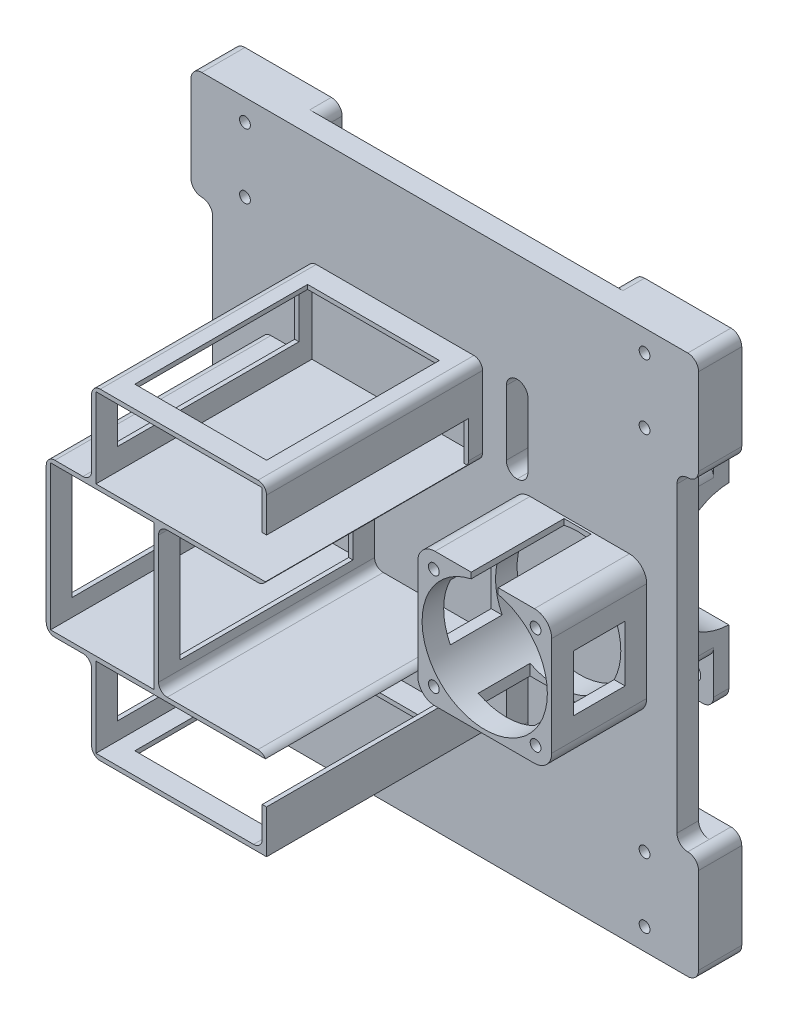
from build123d import *

# Parameters (mm, degrees)
ESQUISSE1_R              = 0.005
ESQUISSE1_W              = 10
ESQUISSE1_H              = 40
BOSS_EXTRU_2_DEPTH       = 10
ESQUISSE4_W              = 50
ESQUISSE4_H              = 50
BOSS_EXTRU_3_DEPTH       = 10
ESQUISSE6_W              = 20
ESQUISSE6_H              = 78
BOSS_EXTRU_5_DEPTH       = 45
CONG_1_R                 = 5
ESQUISSE8_R              = 28.5
ENL_V_MAT_EXTRU_2_DEPTH  = 100
ESQUISSE12_W             = 20
ESQUISSE12_H             = 8
BOSS_EXTRU_6_DEPTH       = 20
ESQUISSE13_W             = 20
ESQUISSE13_H             = 8
BOSS_EXTRU_7_DEPTH       = 20
CONG_55_R                = 5
ESQUISSE14_R             = 4
ENL_V_MAT_EXTRU_4_DEPTH  = 10
ESQUISSE15_W             = 20
ESQUISSE15_H             = 1
ENL_V_MAT_EXTRU_5_DEPTH  = 120
ESQUISSE19_W             = 62
ESQUISSE19_H             = 62
ESQUISSE19_W_2           = 40
ESQUISSE19_H_2           = 40
BOSS_EXTRU_8_DEPTH       = 44
ESQUISSE20_R             = 29
ESQUISSE20_R_2           = 15
ENL_V_MAT_EXTRU_7_DEPTH  = 44
CONG_57_R                = 8
ESQUISSE21_W             = 12.5
ESQUISSE21_H             = 6
ENL_V_MAT_EXTRU_8_DEPTH  = 43
ENL_V_MAT_EXTRU_9_DEPTH  = 10
ESQUISSE23_R             = 2.5
ENL_V_MAT_EXTRU_10_DEPTH = 10
ESQUISSE24_W             = 24
ESQUISSE24_H             = 26
ENL_V_MAT_EXTRU_11_DEPTH = 66
ESQUISSE25_W             = 26
ESQUISSE25_H             = 24
ENL_V_MAT_EXTRU_12_DEPTH = 42
BOSS_EXTRU_9_DEPTH       = 100
ESQUISSE31_W             = 77
ESQUISSE31_H             = 37
ESQUISSE31_W_2           = 48
ESQUISSE31_H_2           = 67
ENL_V_MAT_EXTRU_17_DEPTH = 100
ESQUISSE35_W             = 61
ESQUISSE35_H             = 80
ENL_V_MAT_EXTRU_20_DEPTH = 2
ESQUISSE36_W             = 84
ESQUISSE36_H             = 19
ENL_V_MAT_EXTRU_26_DEPTH = 2
ESQUISSE37_W             = 80
ESQUISSE37_H             = 51
ENL_V_MAT_EXTRU_22_DEPTH = 52
CONG_58_R                = 4
ESQUISSE38_W             = 61
ESQUISSE38_H             = 80
ENL_V_MAT_EXTRU_23_DEPTH = 2
ESQUISSE39_W             = 93.5
ESQUISSE39_H             = 19
ESQUISSE39_W_2           = 80
ENL_V_MAT_EXTRU_24_DEPTH = 2
ESQUISSE42_R             = 2.5
ENL_V_MAT_EXTRU_29_DEPTH = 10
ESQUISSE43_R             = 2.6
ENL_V_MAT_EXTRU_30_DEPTH = 20


with BuildPart() as part:
    # Esquisse1 → Boss.-Extru.2 (new body)
    with BuildSketch(Plane.XY):
        Polygon((235, 50), (235, 0), (0, 0), (0, 50), (10, 50), (10, 200), (0, 200), (0, 250), (235, 250), (235, 200), (225, 200), (225, 50), align=None)
        with Locations((117.5, 125)):
            Circle(ESQUISSE1_R, mode=Mode.SUBTRACT)
        with Locations((151, 70)):
            Rectangle(ESQUISSE1_W, ESQUISSE1_H, mode=Mode.SUBTRACT)
        with Locations((151, 180)):
            Rectangle(ESQUISSE1_W, ESQUISSE1_H, mode=Mode.SUBTRACT)
    extrude(amount=BOSS_EXTRU_2_DEPTH)

    # Esquisse4 → Boss.-Extru.3 (add)
    with BuildSketch(Plane(origin=(0, 0, 0), x_dir=(-1, 0, 0), z_dir=(0, 0, -1))):
        with Locations((-25, 225)):
            Rectangle(ESQUISSE4_W, ESQUISSE4_H)
        with Locations((-210, 225)):
            Rectangle(ESQUISSE4_W, ESQUISSE4_H)
        with Locations((-210, 25)):
            Rectangle(ESQUISSE4_W, ESQUISSE4_H)
        with Locations((-25, 25)):
            Rectangle(ESQUISSE4_W, ESQUISSE4_H)
    extrude(amount=BOSS_EXTRU_3_DEPTH)

    # Esquisse6 → Boss.-Extru.5 (add)
    with BuildSketch(Plane(origin=(0, 0, 0), x_dir=(-1, 0, 0), z_dir=(0, 0, -1))):
        with Locations((-116, 125)):
            Rectangle(ESQUISSE6_W, ESQUISSE6_H)
        with Locations((-185, 125)):
            Rectangle(ESQUISSE6_W, ESQUISSE6_H)
    extrude(amount=BOSS_EXTRU_5_DEPTH)

    # Congé1
    cong_1_edges = [part.edges().sort_by_distance(p)[0] for p in [
        (50, 250, -5),
        (50, 200, -5),
        (185, 250, -5),
        (185, 200, -5),
        (235, 50, 0),
        (235, 200, 0),
        (0, 50, 0),
        (0, 200, 0),
        (225, 50, 5),
        (225, 200, 5),
        (10, 50, 5),
        (10, 200, 5),
        (235, 250, 0),
        (0, 250, 0),
        (0, 0, 0),
        (235, 0, 0),
        (50, 50, -5),
        (185, 50, -5),
        (185, 0, -5),
        (50, 0, -5),
        (146, 50, 5),
        (156, 50, 5),
        (156, 90, 5),
        (146, 90, 5),
        (156, 160, 5),
        (146, 160, 5),
        (156, 200, 5),
        (146, 200, 5),
    ]]
    fillet(cong_1_edges, radius=CONG_1_R - 0.0001)  # a hair under: the kernel refuses the full size

    # Esquisse8 → Enlèv. mat.-Extru.2 (cut)
    with BuildSketch(Plane(origin=(195, 0, 0), x_dir=(0, 0, -1), z_dir=(1, 0, 0))):
        with Locations((45, 125)):
            Circle(ESQUISSE8_R)
    extrude(amount=-ENL_V_MAT_EXTRU_2_DEPTH, mode=Mode.SUBTRACT)

    # Esquisse12 → Boss.-Extru.6 (add)
    with BuildSketch(Plane(origin=(0, 164, 0), x_dir=(1, 0, 0), z_dir=(0, 1, 0))):
        with Locations((116, 41)):
            Rectangle(ESQUISSE12_W, ESQUISSE12_H)
        with Locations((185, 41)):
            Rectangle(ESQUISSE12_W, ESQUISSE12_H)
    extrude(amount=BOSS_EXTRU_6_DEPTH)

    # Esquisse13 → Boss.-Extru.7 (add)
    with BuildSketch(Plane.XZ.offset(-86)):
        with Locations((116, -41)):
            Rectangle(ESQUISSE13_W, ESQUISSE13_H)
        with Locations((185, -41)):
            Rectangle(ESQUISSE13_W, ESQUISSE13_H)
    extrude(amount=BOSS_EXTRU_7_DEPTH)

    # Congé55
    cong_55_edges = [part.edges().sort_by_distance(p)[0] for p in [
        (126, 164, -18.5),
        (106, 164, -18.5),
        (106, 184, -41),
        (126, 184, -41),
        (195, 164, -18.5),
        (175, 164, -18.5),
        (175, 184, -41),
        (195, 184, -41),
        (106, 86, -18.5),
        (126, 86, -18.5),
        (106, 66, -41),
        (126, 66, -41),
        (175, 86, -18.5),
        (195, 86, -18.5),
        (175, 66, -41),
        (195, 66, -41),
    ]]
    fillet(cong_55_edges, radius=CONG_55_R)

    # Esquisse14 → Enlèv. mat.-Extru.4 (cut)
    with BuildSketch(Plane(origin=(0, 0, -45), x_dir=(-1, 0, 0), z_dir=(0, 0, -1))):
        with Locations((-185, 173.5)):
            Circle(ESQUISSE14_R)
        with Locations((-116, 173.5)):
            Circle(ESQUISSE14_R)
        with Locations((-116, 76.5)):
            Circle(ESQUISSE14_R)
        with Locations((-185, 76.5)):
            Circle(ESQUISSE14_R)
    extrude(amount=-ENL_V_MAT_EXTRU_4_DEPTH, mode=Mode.SUBTRACT)

    # Esquisse15 → Enlèv. mat.-Extru.5 (cut)
    with BuildSketch(Plane.XZ.offset(-66)):
        with Locations((185, -44.5)):
            Rectangle(ESQUISSE15_W, ESQUISSE15_H)
    extrude(amount=-ENL_V_MAT_EXTRU_5_DEPTH, mode=Mode.SUBTRACT)

    # Esquisse19 → Boss.-Extru.8 (add)
    with BuildSketch(Plane.XY.offset(10)):
        with Locations((180, 125)):
            Rectangle(ESQUISSE19_W, ESQUISSE19_H)
        with Locations((180, 125)):
            Rectangle(ESQUISSE19_W_2, ESQUISSE19_H_2, mode=Mode.SUBTRACT)
    extrude(amount=BOSS_EXTRU_8_DEPTH)

    # Esquisse20 → Enlèv. mat.-Extru.7 (cut)
    with BuildSketch(Plane.XY.offset(54)):
        with Locations((180, 125)):
            Circle(ESQUISSE20_R)
        with Locations((180, 125)):
            Circle(ESQUISSE20_R_2, mode=Mode.SUBTRACT)
    extrude(amount=-ENL_V_MAT_EXTRU_7_DEPTH, mode=Mode.SUBTRACT)

    # Congé57
    cong_57_edges = [part.edges().sort_by_distance(p)[0] for p in [
        (211, 94, 32),
        (211, 156, 32),
        (149, 156, 32),
        (149, 94, 32),
    ]]
    fillet(cong_57_edges, radius=CONG_57_R)

    # Esquisse21 → Enlèv. mat.-Extru.8 (cut)
    with BuildSketch(Plane.XY.offset(54)):
        with Locations((180, 155)):
            Rectangle(ESQUISSE21_W, ESQUISSE21_H)
    extrude(amount=-ENL_V_MAT_EXTRU_8_DEPTH, mode=Mode.SUBTRACT)

    # Esquisse22 → Enlèv. mat.-Extru.9 (cut)
    with BuildSketch(Plane.XY):
        with BuildLine():
            Line((12.5, 245), (37.5, 245))
            ThreePointArc((37.5, 245), (42.5, 240), (37.5, 235))
            Line((37.5, 235), (12.5, 235))
            ThreePointArc((12.5, 235), (7.5, 240), (12.5, 245))
        make_face()
        with BuildLine():
            Line((12.5, 215), (37.5, 215))
            ThreePointArc((37.5, 215), (42.5, 210), (37.5, 205))
            Line((37.5, 205), (12.5, 205))
            ThreePointArc((12.5, 205), (7.5, 210), (12.5, 215))
        make_face()
        with BuildLine():
            Line((12.5, 35), (37.5, 35))
            ThreePointArc((37.5, 35), (42.5, 40), (37.5, 45))
            Line((37.5, 45), (12.5, 45))
            ThreePointArc((12.5, 45), (7.5, 40), (12.5, 35))
        make_face()
        with BuildLine():
            Line((12.5, 5), (37.5, 5))
            ThreePointArc((37.5, 5), (42.5, 10), (37.5, 15))
            Line((37.5, 15), (12.5, 15))
            ThreePointArc((12.5, 15), (7.5, 10), (12.5, 5))
        make_face()
        with BuildLine():
            Line((222.5, 5), (197.5, 5))
            ThreePointArc((197.5, 5), (192.5, 10), (197.5, 15))
            Line((197.5, 15), (222.5, 15))
            ThreePointArc((222.5, 15), (227.5, 10), (222.5, 5))
        make_face()
        with BuildLine():
            Line((222.5, 35), (197.5, 35))
            ThreePointArc((197.5, 35), (192.5, 40), (197.5, 45))
            Line((197.5, 45), (222.5, 45))
            ThreePointArc((222.5, 45), (227.5, 40), (222.5, 35))
        make_face()
        with BuildLine():
            Line((222.5, 245), (197.5, 245))
            ThreePointArc((197.5, 245), (192.5, 240), (197.5, 235))
            Line((197.5, 235), (222.5, 235))
            ThreePointArc((222.5, 235), (227.5, 240), (222.5, 245))
        make_face()
        with BuildLine():
            Line((222.5, 215), (197.5, 215))
            ThreePointArc((197.5, 215), (192.5, 210), (197.5, 205))
            Line((197.5, 205), (222.5, 205))
            ThreePointArc((222.5, 205), (227.5, 210), (222.5, 215))
        make_face()
    extrude(amount=-ENL_V_MAT_EXTRU_9_DEPTH, mode=Mode.SUBTRACT)

    # Esquisse23 → Enlèv. mat.-Extru.10 (cut)
    with BuildSketch(Plane.XY):
        with Locations((25, 240)):
            Circle(ESQUISSE23_R)
        with Locations((25, 210)):
            Circle(ESQUISSE23_R)
        with Locations(Location((25, 40, 0), (0, 0, 180))):
            Circle(ESQUISSE23_R)
        with Locations(Location((25, 10, 0), (0, 0, 180))):
            Circle(ESQUISSE23_R)
        with Locations((210, 10)):
            Circle(ESQUISSE23_R)
        with Locations((210, 40)):
            Circle(ESQUISSE23_R)
        with Locations(Location((210, 210, 0), (0, 0, 180))):
            Circle(ESQUISSE23_R)
        with Locations(Location((210, 240, 0), (0, 0, 180))):
            Circle(ESQUISSE23_R)
    extrude(amount=ENL_V_MAT_EXTRU_10_DEPTH, mode=Mode.SUBTRACT)

    # Esquisse24 → Enlèv. mat.-Extru.11 (cut, symmetric)
    with BuildSketch(Plane.ZY.offset(-149)):
        with Locations((32, 125)):
            Rectangle(ESQUISSE24_W, ESQUISSE24_H)
    extrude(amount=ENL_V_MAT_EXTRU_11_DEPTH, both=True, mode=Mode.SUBTRACT)

    # Esquisse25 → Enlèv. mat.-Extru.12 (cut)
    with BuildSketch(Plane.XZ.offset(-94)):
        with Locations((180, 32)):
            Rectangle(ESQUISSE25_W, ESQUISSE25_H)
    extrude(amount=-ENL_V_MAT_EXTRU_12_DEPTH, mode=Mode.SUBTRACT)

    # Esquisse27 → Boss.-Extru.9 (add)
    with BuildSketch(Plane.XY.offset(10)):
        Polygon((135, 50.5), (54, 50.5), (54, 89.5), (33, 89.5), (33, 160.5), (54, 160.5), (54, 199.5), (135, 199.5), (135, 158.5), (85, 158.5), (85, 91.5), (135, 91.5), align=None)
    extrude(amount=BOSS_EXTRU_9_DEPTH)

    # Esquisse31 → Enlèv. mat.-Extru.17 (cut)
    with BuildSketch(Plane.XY.offset(110)):
        with Locations((94.5, 179)):
            Rectangle(ESQUISSE31_W, ESQUISSE31_H)
        with Locations((94.5, 71)):
            Rectangle(ESQUISSE31_W, ESQUISSE31_H)
        with Locations((59, 125)):
            Rectangle(ESQUISSE31_W_2, ESQUISSE31_H_2)
    extrude(amount=-ENL_V_MAT_EXTRU_17_DEPTH, mode=Mode.SUBTRACT)

    # Esquisse35 → Enlèv. mat.-Extru.20 (cut)
    with BuildSketch(Plane.XZ.offset(-50.5)):
        with Locations((94.5, 60)):
            Rectangle(ESQUISSE35_W, ESQUISSE35_H)
    extrude(amount=-ENL_V_MAT_EXTRU_20_DEPTH, mode=Mode.SUBTRACT)

    # Esquisse36 → Enlèv. mat.-Extru.26 (cut)
    with BuildSketch(Plane.ZY.offset(-54)):
        with Locations((58, 180)):
            Rectangle(ESQUISSE36_W, ESQUISSE36_H)
        with Locations((58, 70)):
            Rectangle(ESQUISSE36_W, ESQUISSE36_H)
    extrude(amount=-ENL_V_MAT_EXTRU_26_DEPTH, mode=Mode.SUBTRACT)

    # Esquisse37 → Enlèv. mat.-Extru.22 (cut)
    with BuildSketch(Plane.ZY.offset(-33)):
        with Locations((60, 125)):
            Rectangle(ESQUISSE37_W, ESQUISSE37_H)
    extrude(amount=-ENL_V_MAT_EXTRU_22_DEPTH, mode=Mode.SUBTRACT)

    # Congé58
    cong_58_edges = [part.edges().sort_by_distance(p)[0] for p in [
        (133, 52.5, 60),
        (135, 158.5, 60),
        (135, 199.5, 60),
        (54, 199.5, 60),
        (54, 160.5, 60),
        (33, 160.5, 60),
        (33, 89.5, 60),
        (54, 89.5, 60),
        (54, 50.5, 60),
        (135, 91.5, 60),
        (85, 91.5, 60),
        (85, 158.5, 60),
    ]]
    fillet(cong_58_edges, radius=CONG_58_R)

    # Esquisse38 → Enlèv. mat.-Extru.23 (cut)
    with BuildSketch(Plane(origin=(0, 199.5, 0), x_dir=(1, 0, 0), z_dir=(0, 1, 0))):
        with Locations((94.5, -60)):
            Rectangle(ESQUISSE38_W, ESQUISSE38_H)
    extrude(amount=-ENL_V_MAT_EXTRU_23_DEPTH, mode=Mode.SUBTRACT)

    # Esquisse39 → Enlèv. mat.-Extru.24 (cut)
    with BuildSketch(Plane(origin=(135, 0, 0), x_dir=(0, 0, -1), z_dir=(1, 0, 0))):
        with Locations((-63.25, 170)):
            Rectangle(ESQUISSE39_W, ESQUISSE39_H)
        with Locations((-70, 80)):
            Rectangle(ESQUISSE39_W_2, ESQUISSE39_H)
    extrude(amount=-ENL_V_MAT_EXTRU_24_DEPTH, mode=Mode.SUBTRACT)

    # Esquisse42 → Enlèv. mat.-Extru.29 (cut)
    with BuildSketch(Plane.XY.offset(54)):
        with Locations((156.45, 148.55)):
            Circle(ESQUISSE42_R)
        with Locations(Location((203.55, 148.55, 0), (0, 0, 180))):
            Circle(ESQUISSE42_R)
        with Locations((203.55, 101.45)):
            Circle(ESQUISSE42_R)
        with Locations(Location((156.45, 101.45, 0), (0, 0, 180))):
            Circle(ESQUISSE42_R)
    extrude(amount=-ENL_V_MAT_EXTRU_29_DEPTH, mode=Mode.SUBTRACT)

    # Esquisse43 → Enlèv. mat.-Extru.30 (cut)
    with BuildSketch(Plane.ZY.offset(-106)):
        with Locations(Location((-21.47, 148.53, 0), (0, 0, 270))):
            Circle(ESQUISSE43_R)
        with Locations(Location((-21.47, 101.47, 0), (0, 0, 90))):
            Circle(ESQUISSE43_R)
    extrude(amount=-ENL_V_MAT_EXTRU_30_DEPTH, mode=Mode.SUBTRACT)


solid = part.part
